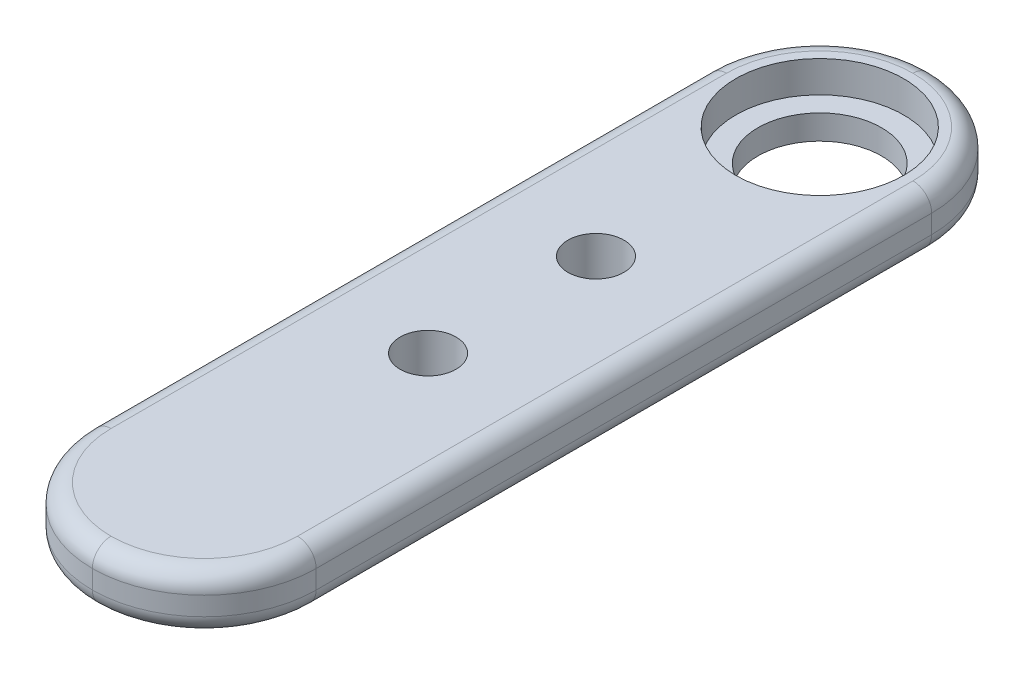
from build123d import *

# Parameters (mm, degrees)
SKETCH1_W           = 25.4
SKETCH1_H           = 95.25
SKETCH1_R           = 3.175
BOSS_EXTRUDE1_DEPTH = 6.35
FILLET1_R           = 12.7
FILLET2_R           = 2.116666667
SKETCH5_R           = 9.525
SKETCH5_R_2         = 7.016807895
CUT_EXTRUDE2_DEPTH  = 3.571875
SKETCH5_2_R         = 7.016807895
CUT_EXTRUDE3_DEPTH  = 6.35


with BuildPart() as part:
    # Sketch1 → Boss-Extrude1 (new body)
    with BuildSketch(Plane(origin=(0, 0, 0), x_dir=(1, 0, 0), z_dir=(0, 1, 0))):
        Rectangle(SKETCH1_W, SKETCH1_H)
        with Locations(Location((0, 9.525, 0), (0, 0, 270))):
            Circle(SKETCH1_R, mode=Mode.SUBTRACT)
        with Locations(Location((0, -9.525, 0), (0, 0, 270))):
            Circle(SKETCH1_R, mode=Mode.SUBTRACT)
    extrude(amount=BOSS_EXTRUDE1_DEPTH)

    # Fillet1
    fillet1_edges = [part.edges().sort_by_distance(p)[0] for p in [
        (-12.7, 3.175, -47.625),
        (12.7, 3.175, -47.625),
        (-12.7, 3.175, 47.625),
        (12.7, 3.175, 47.625),
    ]]
    fillet(fillet1_edges, radius=FILLET1_R - 0.0001)  # a hair under: the kernel refuses the full size

    # Fillet2
    fillet2_edges = [part.edges().sort_by_distance(p)[0] for p in [
        (-12.7, 0, 0),
        (-12.7, 6.35, 0),
        (12.7, 0, 0),
        (8.98028541, 0, 43.90528541),
        (-8.98028541, 0, 43.90528541),
        (8.98028541, 0, -43.90528541),
        (-8.98028541, 0, -43.90528541),
        (12.7, 6.35, 0),
        (8.98028541, 6.35, 43.90528541),
        (-8.98028541, 6.35, 43.90528541),
        (8.98028541, 6.35, -43.90528541),
        (-8.98028541, 6.35, -43.90528541),
    ]]
    fillet(fillet2_edges, radius=FILLET2_R)

    # Sketch5 → Cut-Extrude2 (cut)
    with BuildSketch(Plane(origin=(0, 6.35, 0), x_dir=(1, 0, 0), z_dir=(0, 1, 0))):
        with Locations(Location((0, 34.925, 0), (0, 0, 270))):
            Circle(SKETCH5_R)
        with Locations(Location((0, 34.925, 0), (0, 0, 270))):
            Circle(SKETCH5_R_2, mode=Mode.SUBTRACT)
    extrude(amount=-CUT_EXTRUDE2_DEPTH, mode=Mode.SUBTRACT)

    # Sketch5<2> → Cut-Extrude3 (cut)
    with BuildSketch(Plane(origin=(0, 6.35, 0), x_dir=(1, 0, 0), z_dir=(0, 1, 0))):
        with Locations(Location((0, 34.925, 0), (0, 0, 270))):
            Circle(SKETCH5_2_R)
    extrude(amount=-CUT_EXTRUDE3_DEPTH, mode=Mode.SUBTRACT)


solid = part.part
